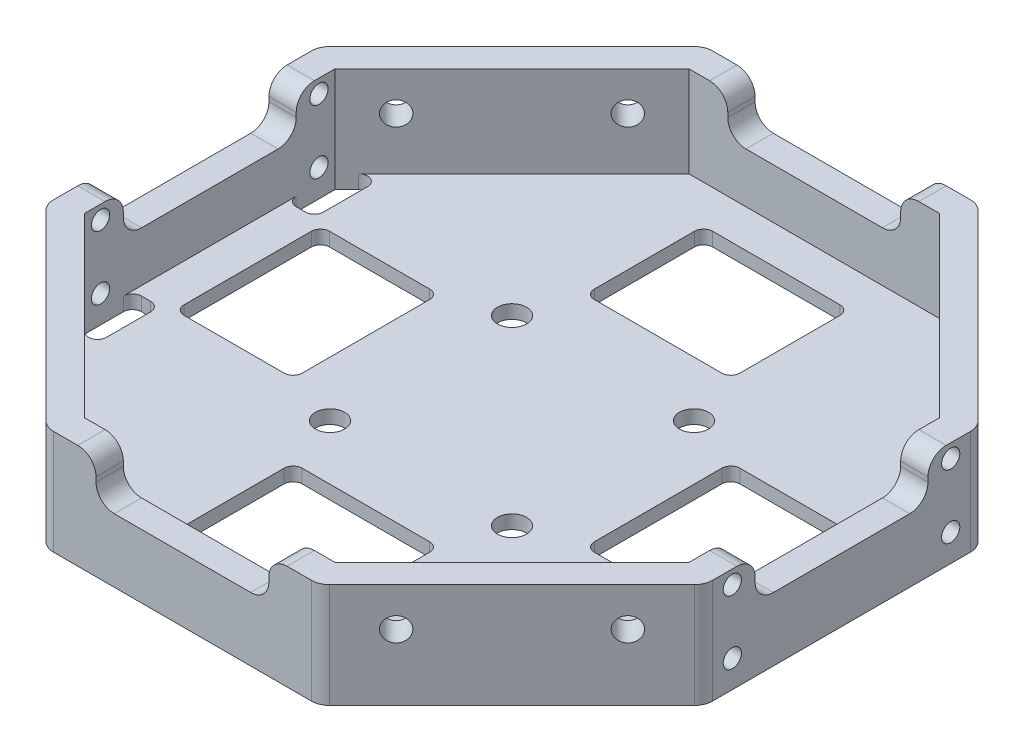
from build123d import *

# Parameters (mm, degrees)
BOSS_EXTRUDE1_DEPTH = 11.5
SHELL1_T            = -3
SKETCH3_R           = 1.3
CUT_EXTRUDE1_DEPTH  = 94
SKETCH4_R           = 1.3
CUT_EXTRUDE2_DEPTH  = 94
FILLET1_R           = 2
CUT_EXTRUDE3_DEPTH  = 79
CUT_EXTRUDE4_DEPTH  = 79
FILLET2_R           = 2
SKETCH7_R           = 1.6
CUT_EXTRUDE5_DEPTH  = 10
SKETCH8_R           = 1
CUT_EXTRUDE7_DEPTH  = 79
CUT_EXTRUDE8_DEPTH  = 1.5
CUT_EXTRUDE9_DEPTH  = 1.5
FILLET3_R           = 1
CUT_EXTRUDE10_DEPTH = 10
FILLET4_R           = 1


with BuildPart() as part:
    # Sketch1 → Boss-Extrude1 (new body)
    with BuildSketch(Plane(origin=(0, 0, 0), x_dir=(1, 0, 0), z_dir=(0, 1, 0))):
        Polygon((-11.213203436, 40), (18.786796564, 40), (40, 18.786796564), (40, -11.213203436), (18.786796564, -32.426406871), (-11.213203436, -32.426406871), (-32.426406871, -11.213203436), (-32.426406871, 18.786796564), align=None)
    extrude(amount=BOSS_EXTRUDE1_DEPTH)

    # Shell1
    shell1_openings = [part.faces().sort_by_distance(p)[0] for p in [
        (3.786796564, 11.5, -3.786796564),
    ]]
    offset(amount=SHELL1_T, openings=shell1_openings, kind=Kind.INTERSECTION)

    # Sketch3 → Cut-Extrude1 (cut)
    with BuildSketch(Plane(origin=(-21.819805153, 0, 21.819805153), x_dir=(0.7071067811865558, 0, 0.7071067811865392), z_dir=(-0.7071067811865392, 0, 0.7071067811865558))):
        with Locations((-9, 7.25)):
            Circle(SKETCH3_R)
        with Locations((9, 7.25)):
            Circle(SKETCH3_R)
    extrude(amount=-CUT_EXTRUDE1_DEPTH, mode=Mode.SUBTRACT)

    # Sketch4 → Cut-Extrude2 (cut)
    with BuildSketch(Plane(origin=(-25.606601718, 0, -25.606601718), x_dir=(-0.7071067811865556, 0, 0.7071067811865396), z_dir=(-0.7071067811865396, 0, -0.7071067811865556))):
        with Locations((-14.355339059, 7.25)):
            Circle(SKETCH4_R)
        with Locations((3.644660941, 7.25)):
            Circle(SKETCH4_R)
    extrude(amount=-CUT_EXTRUDE2_DEPTH, mode=Mode.SUBTRACT)

    # Fillet1
    fillet1_edges = [part.edges().sort_by_distance(p)[0] for p in [
        (40, 5.75, 11.213203436),
        (18.786796564, 5.75, 32.426406871),
        (40, 5.75, -18.786796564),
        (18.786796564, 5.75, -40),
        (-11.213203436, 5.75, -40),
        (-32.426406871, 5.75, -18.786796564),
        (-32.426406871, 5.75, 11.213203436),
        (-11.213203436, 5.75, 32.426406871),
    ]]
    fillet(fillet1_edges, radius=FILLET1_R)

    # Sketch5 → Cut-Extrude3 (cut)
    with BuildSketch(Plane.XY.offset(32.426406871)):
        Polygon((3.786796564, 7), (13.286796564, 7), (13.286796564, 11.5), (-5.713203436, 11.5), (-5.713203436, 7), align=None)
    extrude(amount=-CUT_EXTRUDE3_DEPTH, mode=Mode.SUBTRACT)

    # Sketch6 → Cut-Extrude4 (cut)
    with BuildSketch(Plane.ZY.offset(32.426406871)):
        Polygon((-3.786796564, 7), (5.713203436, 7), (5.713203436, 11.5), (-13.286796564, 11.5), (-13.286796564, 7), align=None)
    extrude(amount=-CUT_EXTRUDE4_DEPTH, mode=Mode.SUBTRACT)

    # Fillet2
    fillet2_edges = [part.edges().sort_by_distance(p)[0] for p in [
        (38.5, 11.5, 5.713203436),
        (38.5, 7, 5.713203436),
        (38.5, 11.5, -13.286796564),
        (38.5, 7, -13.286796564),
        (13.286796564, 11.5, 30.926406871),
        (13.286796564, 7, 30.926406871),
        (-5.713203436, 11.5, 30.926406871),
        (-5.713203436, 7, 30.926406871),
        (-30.926406871, 11.5, -13.286796564),
        (-30.926406871, 7, -13.286796564),
        (-30.926406871, 11.5, 5.713203436),
        (-30.926406871, 7, 5.713203436),
        (13.286796564, 11.5, -38.5),
        (13.286796564, 7, -38.5),
        (-5.713203436, 11.5, -38.5),
        (-5.713203436, 7, -38.5),
    ]]
    fillet(fillet2_edges, radius=FILLET2_R)

    # Sketch7 → Cut-Extrude5 (cut)
    with BuildSketch(Plane(origin=(0, 0, 0), x_dir=(-1, 0, 0), z_dir=(0, -1, 0))):
        with Locations((6.213203436, -6.213203436)):
            Circle(SKETCH7_R)
        with Locations((-13.786796564, -6.213203436)):
            Circle(SKETCH7_R)
        with Locations((-13.786796564, 13.786796564)):
            Circle(SKETCH7_R)
        with Locations((6.213203436, 13.786796564)):
            Circle(SKETCH7_R)
    extrude(amount=-CUT_EXTRUDE5_DEPTH, mode=Mode.SUBTRACT)

    # Sketch8 → Cut-Extrude7 (cut)
    with BuildSketch(Plane(origin=(40, 0, 0), x_dir=(0, 0, -1), z_dir=(1, 0, 0))):
        with Locations((-8.213203436, 10)):
            Circle(SKETCH8_R)
        with Locations((-8.213203436, 3)):
            Circle(SKETCH8_R)
        with Locations((15.786796564, 3)):
            Circle(SKETCH8_R)
        with Locations((15.786796564, 10)):
            Circle(SKETCH8_R)
    extrude(amount=-CUT_EXTRUDE7_DEPTH, mode=Mode.SUBTRACT)

    # Sketch10 → Cut-Extrude8 (cut)
    with BuildSketch(Plane(origin=(0, 3, 0), x_dir=(1, 0, 0), z_dir=(0, 1, 0))):
        Polygon((17.544155877, 37), (37, 17.544155877), (37, -9.970562748), (17.544155877, -29.426406871), (-9.970562748, -29.426406871), (-29.426406871, -9.970562748), (-29.426406871, 17.544155877), (-9.970562748, 37), align=None)
    extrude(amount=-CUT_EXTRUDE8_DEPTH, mode=Mode.SUBTRACT)

    # Sketch12 → Cut-Extrude9 (cut)
    with BuildSketch(Plane(origin=(0, 1.5, 0), x_dir=(1, 0, 0), z_dir=(0, 1, 0))):
        Polygon((34, 12.286796564), (37, 12.286796564), (37, 17.544155877), (34, 20.544155877), align=None)
        Polygon((37, -9.970562748), (37, -4.713203436), (34, -4.713203436), (34, -12.970562748), align=None)
        Polygon((-26.426406871, -4.713203436), (-29.426406871, -4.713203436), (-29.426406871, -9.970562748), (-26.426406871, -12.970562748), align=None)
        Polygon((-26.426406871, 20.544155877), (-29.426406871, 17.544155877), (-29.426406871, 12.286796564), (-26.426406871, 12.286796564), align=None)
    extrude(amount=-CUT_EXTRUDE9_DEPTH, mode=Mode.SUBTRACT)

    # Fillet3
    fillet3_edges = [part.edges().sort_by_distance(p)[0] for p in [
        (34, 0.75, -12.286796564),
        (34, 0.75, -20.544155877),
        (37, 0.75, -12.286796564),
        (37, 0.75, 4.713203436),
        (34, 0.75, 4.713203436),
        (34, 0.75, 12.970562748),
        (-26.426406871, 0.75, 4.713203436),
        (-26.426406871, 0.75, 12.970562748),
        (-29.426406871, 0.75, 4.713203436),
        (-26.426406871, 0.75, -12.286796564),
        (-29.426406871, 0.75, -12.286796564),
        (-26.426406871, 0.75, -20.544155877),
    ]]
    fillet(fillet3_edges, radius=FILLET3_R)

    # Sketch13 → Cut-Extrude10 (cut)
    with BuildSketch(Plane(origin=(0, 1.5, 0), x_dir=(1, 0, 0), z_dir=(0, 1, 0))):
        Polygon((3.786796564, 19.838268012), (-4.213203436, 19.838268012), (-4.213203436, 32.838268012), (2.581997553, 32.838268012), (11.786796564, 32.838268012), (11.786796564, 19.838268012), align=None)
        Polygon((19.838268012, 3.786796564), (19.838268012, -4.213203436), (32.838268012, -4.213203436), (32.838268012, 4.991595576), (32.838268012, 11.786796564), (19.838268012, 11.786796564), align=None)
        Polygon((3.786796564, -12.264674884), (-4.213203436, -12.264674884), (-4.213203436, -25.264674884), (4.991595576, -25.264674884), (11.786796564, -25.264674884), (11.786796564, -12.264674884), align=None)
        Polygon((-12.264674884, 3.786796564), (-12.264674884, 11.786796564), (-25.264674884, 11.786796564), (-25.264674884, 2.581997553), (-25.264674884, -4.213203436), (-12.264674884, -4.213203436), align=None)
    extrude(amount=-CUT_EXTRUDE10_DEPTH, mode=Mode.SUBTRACT)

    # Fillet4
    fillet4_edges = [part.edges().sort_by_distance(p)[0] for p in [
        (11.786796564, 0.75, 12.264674884),
        (-4.213203436, 0.75, 12.264674884),
        (-4.213203436, 0.75, 25.264674884),
        (11.786796564, 0.75, 25.264674884),
        (32.838268012, 0.75, 4.213203436),
        (19.838268012, 0.75, 4.213203436),
        (19.838268012, 0.75, -11.786796564),
        (32.838268012, 0.75, -11.786796564),
        (11.786796564, 0.75, -19.838268012),
        (11.786796564, 0.75, -32.838268012),
        (-4.213203436, 0.75, -19.838268012),
        (-4.213203436, 0.75, -32.838268012),
        (-12.264674884, 0.75, 4.213203436),
        (-25.264674884, 0.75, 4.213203436),
        (-25.264674884, 0.75, -11.786796564),
        (-12.264674884, 0.75, -11.786796564),
    ]]
    fillet(fillet4_edges, radius=FILLET4_R)


solid = part.part
